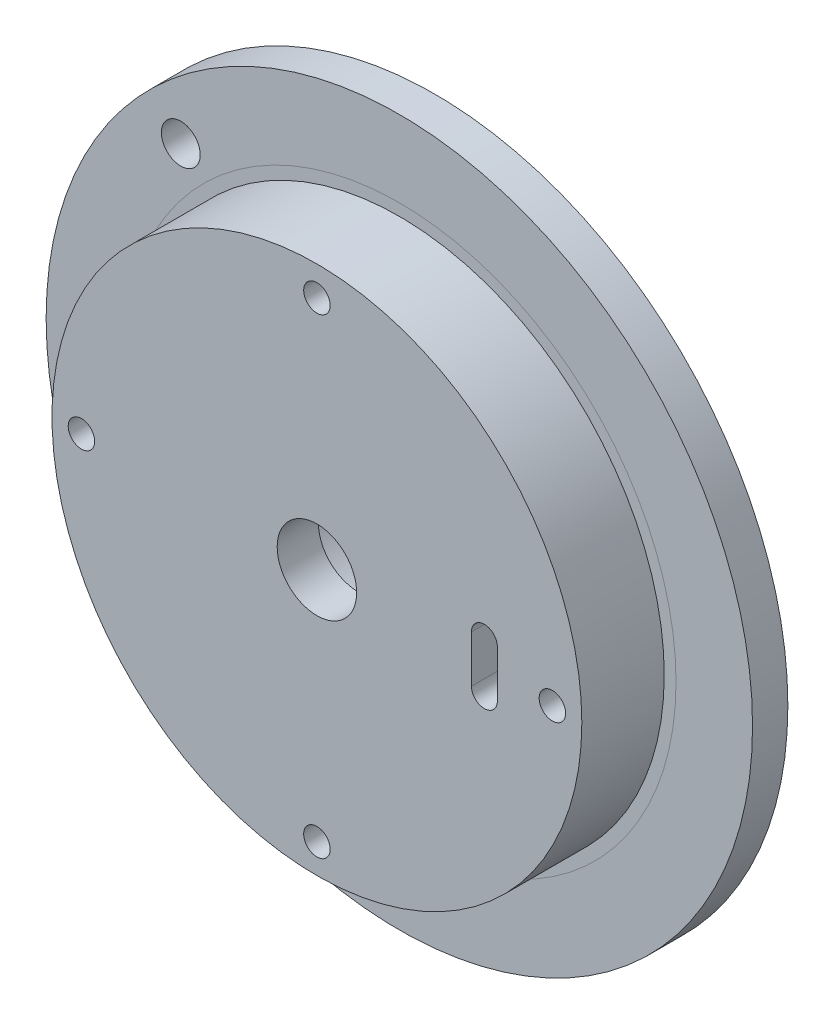
from build123d import *

# Parameters (mm, degrees)
ESQUISSE1_R                         = 60
CYLINDRE_PRINCIPAL_DEPTH            = 6
BOSSAGE_RV_R                        = 45
LOGEMENT_RV_DEPTH                   = 20
ESQUISSE20_R                        = 7.5
BOSS_EXTRU_2_DEPTH                  = 6
TROUS_AV_D                          = 4.5
TROUS_AV_CSINK_D                    = 4.85
TROUS_AV_CSINK_ANGLE                = 90
DIAM_TRE_DU_PER_AGE_4_4_4_4_2_DEPTH = 20
D_AGEMENT_SM_D                      = 6.6
TROU_RECOVERY_D                     = 13.5
TROU_RECOVERY_CSINK_D               = 13.55
TROU_RECOVERY_CSINK_ANGLE           = 90
ESQUISSE40_R                        = 16
ENL_V_MAT_EXTRU_2_DEPTH             = 13
CONG_9_R                            = 2
ESQUISSE15_W                        = 5
ESQUISSE15_H                        = 6
CONG_10_R                           = 2


# Read off the part's stored shape, not the designer's step: Diamètre du perçage Ø4.4 (4.4)2
with BuildPart() as part:
    # Esquisse1 → Cylindre principal (new body)
    with BuildSketch(Plane.XY):
        Circle(ESQUISSE1_R)
    extrude(amount=CYLINDRE_PRINCIPAL_DEPTH)

    # Bossage RV → Logement RV (add)
    with BuildSketch(Plane.XY):
        Circle(BOSSAGE_RV_R)
    extrude(amount=LOGEMENT_RV_DEPTH)

    # Esquisse20 → Boss.-Extru.2 (add)
    with BuildSketch(Plane.XY):
        with Locations((-37.123106012, 37.123106012)):
            Circle(ESQUISSE20_R)
    extrude(amount=BOSS_EXTRU_2_DEPTH)

    # Trous AV (through all)
    with Locations(Plane(origin=(0, 40, 0), x_dir=(-1, 0, 0), z_dir=(0, 0, -1))):
        with Locations((0, 0), (40, -40), (0, -80), (-40, -40)):
            CounterSinkHole(TROUS_AV_D / 2, TROUS_AV_CSINK_D / 2, counter_sink_angle=TROUS_AV_CSINK_ANGLE)

    # Diamètre du perçage Ø4.4 (4.4)2 outline → Diamètre du perçage Ø4.4 (4.4)2 (cut)
    with BuildSketch(Plane.XY):
        with BuildLine():
            ThreePointArc((30.65064108, 4), (28.45064108, 6.2), (26.25064108, 4))
            Line((26.25064108, 4), (26.25064108, -4))
            ThreePointArc((26.25064108, -4), (28.45064108, -6.2), (30.65064108, -4))
            Line((30.65064108, -4), (30.65064108, 4))
        make_face()
    extrude(amount=DIAM_TRE_DU_PER_AGE_4_4_4_4_2_DEPTH, mode=Mode.SUBTRACT)

    # Déagement SM (through all)
    with Locations(Plane.XY.offset(6)):
        with Locations((-37.123106012, 37.123106012)):
            Hole(D_AGEMENT_SM_D / 2)

    # Trou recovery (through all)
    with Locations(Plane(origin=(0, 0, 0), x_dir=(-1, 0, 0), z_dir=(0, 0, -1))):
        with Locations((0, 0)):
            CounterSinkHole(TROU_RECOVERY_D / 2, TROU_RECOVERY_CSINK_D / 2, counter_sink_angle=TROU_RECOVERY_CSINK_ANGLE)

    # Esquisse40 → Enlèv. mat.-Extru.2 (cut)
    with BuildSketch(Plane(origin=(0, 0, 0), x_dir=(-1, 0, 0), z_dir=(0, 0, -1))):
        Circle(ESQUISSE40_R)
    extrude(amount=-ENL_V_MAT_EXTRU_2_DEPTH, mode=Mode.SUBTRACT)

    # Congé9
    cong_9_edges = [part.edges().sort_by_distance(p)[0] for p in [
        (16, 0, 0),
    ]]
    fillet(cong_9_edges, radius=CONG_9_R)

    # Esquisse15 → Trou caméra (revolve, cut)
    with BuildSketch(Plane(origin=(-23.641512829, -24.949340174, 6), x_dir=(0, -1, 0), z_dir=(1, 0, 0))):
        with Locations((2.5, 3)):
            Rectangle(ESQUISSE15_W, ESQUISSE15_H)
    revolve(axis=Axis((-23.641512829, -24.949340174, 12.35), (0, 0, -1)), mode=Mode.SUBTRACT)

    # Congé10
    cong_10_edges = [part.edges().sort_by_distance(p)[0] for p in [
        (16, 0, 13),
    ]]
    fillet(cong_10_edges, radius=CONG_10_R)


solid = part.part
